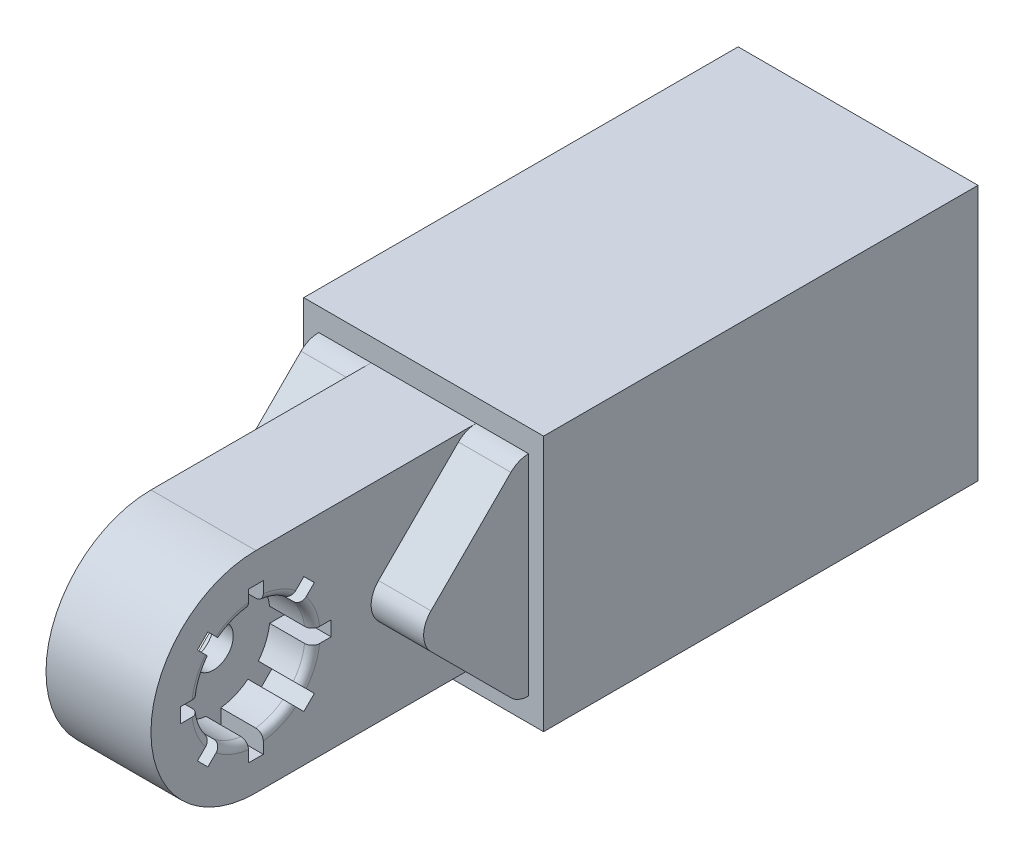
from build123d import *

# Parameters (mm, degrees)
SKETCH2_W                = 42
SKETCH2_H                = 42
BOSS_EXTRUDE1_DEPTH      = 89
SKETCH3_W                = 21
SKETCH3_H                = 42
BOSS_EXTRUDE2_DEPTH      = 42
BOSS_EXTRUDE3_DEPTH      = 21
SKETCH9_R                = 11.35
CUT_EXTRUDE2_DEPTH       = 8.5
CUT_EXTRUDE3_START       = -8.5
SKETCH11_R               = 11.35
CUT_EXTRUDE3_DEPTH       = 8.5
SKETCH12_R               = 3.975
CUT_EXTRUDE4_DEPTH       = 156.157984003
BOSS_EXTRUDE4_DEPTH      = 10.5
BOSS_EXTRUDE4_DEPTH_BACK = 31.5
FILLET1_R                = 5
FILLET2_R                = 5
FILLET3_R                = 5
FILLET4_R                = 5
FILLET5_R                = 5
FILLET6_R                = 5
FILLET7_R                = 1.5
FILLET8_R                = 1.5
SKETCH21_W               = 2.95860585
SKETCH21_H               = 4.417
CUT_EXTRUDE5_DEPTH       = 8.5
CIRPATTERN2_COUNT        = 8
MIRROR1_COPY_1_SKETCH_W  = 2.95860585
MIRROR1_COPY_1_SKETCH_H  = 4.417
MIRROR1_COPY_1_DEPTH     = 8.5
MIRROR1_COPY_2_SKETCH_W  = 2.95860585
MIRROR1_COPY_2_SKETCH_H  = 4.417
MIRROR1_COPY_2_DEPTH     = 8.5
MIRROR1_COPY_3_SKETCH_W  = 2.95860585
MIRROR1_COPY_3_SKETCH_H  = 4.417
MIRROR1_COPY_3_DEPTH     = 8.5
MIRROR1_COPY_4_SKETCH_W  = 2.95860585
MIRROR1_COPY_4_SKETCH_H  = 4.417
MIRROR1_COPY_4_DEPTH     = 8.5
MIRROR1_COPY_5_SKETCH_W  = 2.95860585
MIRROR1_COPY_5_SKETCH_H  = 4.417
MIRROR1_COPY_5_DEPTH     = 8.5
MIRROR1_COPY_6_SKETCH_W  = 2.95860585
MIRROR1_COPY_6_SKETCH_H  = 4.417
MIRROR1_COPY_6_DEPTH     = 8.5
MIRROR1_COPY_7_SKETCH_W  = 2.95860585
MIRROR1_COPY_7_SKETCH_H  = 4.417
MIRROR1_COPY_7_DEPTH     = 8.5
MIRROR1_COPY_8_SKETCH_W  = 2.95860585
MIRROR1_COPY_8_SKETCH_H  = 4.417
MIRROR1_COPY_8_DEPTH     = 8.5
SKETCH24_W               = 86.928932188
SKETCH24_H               = 4.545220174
SKETCH24_H_2             = 4.689106432
BOSS_EXTRUDE6_DEPTH      = 42
SKETCH25_W               = 86.928932188
SKETCH25_H               = 51.234326606
BOSS_EXTRUDE7_DEPTH      = 3
SKETCH28_W               = 86.928932188
SKETCH28_H               = 51.234326606
BOSS_EXTRUDE8_DEPTH      = 3
SKETCH30_W               = 62
SKETCH30_H               = 41.004326606
CUT_EXTRUDE6_DEPTH       = 45


with BuildPart() as part:
    # Sketch2 → Boss-Extrude1 (new body)
    with BuildSketch(Plane.XY):
        Rectangle(SKETCH2_W, SKETCH2_H)
    extrude(amount=BOSS_EXTRUDE1_DEPTH)

    # Sketch3 → Boss-Extrude2 (add)
    with BuildSketch(Plane.XY.offset(89)):
        Rectangle(SKETCH3_W, SKETCH3_H)
    extrude(amount=BOSS_EXTRUDE2_DEPTH)

    # Sketch8 → Boss-Extrude3 (add)
    with BuildSketch(Plane.ZY.offset(10.5)):
        with BuildLine():
            Line((131, 21), (131, -21))
            ThreePointArc((131, -21), (152, 0), (131, 21))
        make_face()
    extrude(amount=-BOSS_EXTRUDE3_DEPTH)

    # Sketch9 → Cut-Extrude2 (cut)
    with BuildSketch(Plane.ZY.offset(10.5)):
        with Locations((131, 0)):
            Circle(SKETCH9_R)
    extrude(amount=-CUT_EXTRUDE2_DEPTH, mode=Mode.SUBTRACT)

    # Sketch11 → Cut-Extrude3 (cut)
    with BuildSketch(Plane(origin=(10.5, 0, 0), x_dir=(0, 0, -1), z_dir=(1, 0, 0)).offset(CUT_EXTRUDE3_START)):
        with Locations((-131, 0)):
            Circle(SKETCH11_R)
    extrude(amount=CUT_EXTRUDE3_DEPTH, mode=Mode.SUBTRACT)

    # Sketch12 → Cut-Extrude4 (cut, through all)
    with BuildSketch(Plane.ZY.offset(2)):
        with Locations((131, 0)):
            Circle(SKETCH12_R)
    extrude(amount=-CUT_EXTRUDE4_DEPTH, mode=Mode.SUBTRACT)

    # Sketch20 → Boss-Extrude4 (add, two sides: drawn at the far end of the back side and taken through both)
    with BuildSketch(Plane.ZY.offset(10.5).offset(-BOSS_EXTRUDE4_DEPTH_BACK)):
        Polygon((89, -21), (110, 0), (89, 21), align=None)
    extrude(amount=BOSS_EXTRUDE4_DEPTH + BOSS_EXTRUDE4_DEPTH_BACK)

    # Fillet1
    fillet1_edges = [part.edges().sort_by_distance(p)[0] for p in [
        (15.75, 0, 110),
    ]]
    fillet(fillet1_edges, radius=FILLET1_R)

    # Fillet2
    fillet2_edges = [part.edges().sort_by_distance(p)[0] for p in [
        (-15.75, 0, 110),
    ]]
    fillet(fillet2_edges, radius=FILLET2_R)

    # Fillet3
    fillet3_edges = [part.edges().sort_by_distance(p)[0] for p in [
        (-15.75, -21, 89),
    ]]
    fillet(fillet3_edges, radius=FILLET3_R)

    # Fillet4
    fillet4_edges = [part.edges().sort_by_distance(p)[0] for p in [
        (-15.75, 21, 89),
    ]]
    fillet(fillet4_edges, radius=FILLET4_R)

    # Fillet5
    fillet5_edges = [part.edges().sort_by_distance(p)[0] for p in [
        (15.75, -21, 89),
    ]]
    fillet(fillet5_edges, radius=FILLET5_R)

    # Fillet6
    fillet6_edges = [part.edges().sort_by_distance(p)[0] for p in [
        (15.75, 21, 89),
    ]]
    fillet(fillet6_edges, radius=FILLET6_R)

    # Fillet7
    fillet7_edges = [part.edges().sort_by_distance(p)[0] for p in [
        (-10.5, 0, 119.65),
    ]]
    fillet(fillet7_edges, radius=FILLET7_R)

    # Fillet8
    fillet8_edges = [part.edges().sort_by_distance(p)[0] for p in [
        (10.5, 0, 142.35),
    ]]
    fillet(fillet8_edges, radius=FILLET8_R)

    # Sketch21 → Cut-Extrude5 (cut)
    with BuildSketch(Plane.ZY.offset(10.5)):
        with Locations((131, 12.85)):
            Rectangle(SKETCH21_W, SKETCH21_H)
    cut_extrude5 = extrude(amount=-CUT_EXTRUDE5_DEPTH, mode=Mode.SUBTRACT)

    # CirPattern2: Cut-Extrude5 ×8 about axis
    cirpattern2_axis = Axis((-9, 0, 131), (-1, 0, 0))
    for i in range(1, CIRPATTERN2_COUNT):
        add(cut_extrude5.rotate(cirpattern2_axis, i * 360 / CIRPATTERN2_COUNT), mode=Mode.SUBTRACT)

    # Mirror1 copy 1 sketch → Mirror1 copy 1 (cut)
    with BuildSketch(Plane(origin=(10.5, -92.630988335, 38.369011665), x_dir=(0, 0.7071067811865475, 0.7071067811865476), z_dir=(1, 0, 0))):
        with Locations((131, -12.85)):
            Rectangle(MIRROR1_COPY_1_SKETCH_W, MIRROR1_COPY_1_SKETCH_H)
    extrude(amount=-MIRROR1_COPY_1_DEPTH, mode=Mode.SUBTRACT)

    # Mirror1 copy 2 sketch → Mirror1 copy 2 (cut)
    with BuildSketch(Plane(origin=(10.5, -131, 131), x_dir=(0, 1, 0), z_dir=(1, 0, 0))):
        with Locations((131, -12.85)):
            Rectangle(MIRROR1_COPY_2_SKETCH_W, MIRROR1_COPY_2_SKETCH_H)
    extrude(amount=-MIRROR1_COPY_2_DEPTH, mode=Mode.SUBTRACT)

    # Mirror1 copy 3 sketch → Mirror1 copy 3 (cut)
    with BuildSketch(Plane(origin=(10.5, -92.630988335, 223.630988335), x_dir=(0, 0.7071067811865476, -0.7071067811865475), z_dir=(1, 0, 0))):
        with Locations((131, -12.85)):
            Rectangle(MIRROR1_COPY_3_SKETCH_W, MIRROR1_COPY_3_SKETCH_H)
    extrude(amount=-MIRROR1_COPY_3_DEPTH, mode=Mode.SUBTRACT)

    # Mirror1 copy 4 sketch → Mirror1 copy 4 (cut)
    with BuildSketch(Plane(origin=(10.5, 0, 262), x_dir=(0, 0, -1), z_dir=(1, 0, 0))):
        with Locations((131, -12.85)):
            Rectangle(MIRROR1_COPY_4_SKETCH_W, MIRROR1_COPY_4_SKETCH_H)
    extrude(amount=-MIRROR1_COPY_4_DEPTH, mode=Mode.SUBTRACT)

    # Mirror1 copy 5 sketch → Mirror1 copy 5 (cut)
    with BuildSketch(Plane(origin=(10.5, 92.630988335, 223.630988335), x_dir=(0, -0.7071067811865475, -0.7071067811865477), z_dir=(1, 0, 0))):
        with Locations((131, -12.85)):
            Rectangle(MIRROR1_COPY_5_SKETCH_W, MIRROR1_COPY_5_SKETCH_H)
    extrude(amount=-MIRROR1_COPY_5_DEPTH, mode=Mode.SUBTRACT)

    # Mirror1 copy 6 sketch → Mirror1 copy 6 (cut)
    with BuildSketch(Plane(origin=(10.5, 131, 131), x_dir=(0, -1, 0), z_dir=(1, 0, 0))):
        with Locations((131, -12.85)):
            Rectangle(MIRROR1_COPY_6_SKETCH_W, MIRROR1_COPY_6_SKETCH_H)
    extrude(amount=-MIRROR1_COPY_6_DEPTH, mode=Mode.SUBTRACT)

    # Mirror1 copy 7 sketch → Mirror1 copy 7 (cut)
    with BuildSketch(Plane(origin=(10.5, 92.630988335, 38.369011665), x_dir=(0, -0.7071067811865477, 0.7071067811865474), z_dir=(1, 0, 0))):
        with Locations((131, -12.85)):
            Rectangle(MIRROR1_COPY_7_SKETCH_W, MIRROR1_COPY_7_SKETCH_H)
    extrude(amount=-MIRROR1_COPY_7_DEPTH, mode=Mode.SUBTRACT)

    # Mirror1 copy 8 sketch → Mirror1 copy 8 (cut)
    with BuildSketch(Plane(origin=(10.5, 0, 0), x_dir=(0, 0, 1), z_dir=(1, 0, 0))):
        with Locations((131, -12.85)):
            Rectangle(MIRROR1_COPY_8_SKETCH_W, MIRROR1_COPY_8_SKETCH_H)
    extrude(amount=-MIRROR1_COPY_8_DEPTH, mode=Mode.SUBTRACT)

    # Sketch24 → Boss-Extrude6 (add)
    with BuildSketch(Plane(origin=(21, 0, 0), x_dir=(0, 0, -1), z_dir=(1, 0, 0))):
        with Locations((-43.464466094, 23.272610087)):
            Rectangle(SKETCH24_W, SKETCH24_H)
        with Locations((-43.464466094, -23.344553216)):
            Rectangle(SKETCH24_W, SKETCH24_H_2)
    extrude(amount=-BOSS_EXTRUDE6_DEPTH)

    # Sketch25 → Boss-Extrude7 (add)
    with BuildSketch(Plane(origin=(21, 0, 0), x_dir=(0, 0, -1), z_dir=(1, 0, 0))):
        with Locations((-43.464466094, -0.071943129)):
            Rectangle(SKETCH25_W, SKETCH25_H)
    extrude(amount=BOSS_EXTRUDE7_DEPTH)

    # Sketch28 → Boss-Extrude8 (add)
    with BuildSketch(Plane.ZY.offset(21)):
        with Locations((43.464466094, -0.071943129)):
            Rectangle(SKETCH28_W, SKETCH28_H)
    extrude(amount=BOSS_EXTRUDE8_DEPTH)

    # Sketch30 → Cut-Extrude6 (cut)
    with BuildSketch(Plane.ZY.offset(24)):
        with Locations((50.928932188, -0.071943129)):
            Rectangle(SKETCH30_W, SKETCH30_H)
    extrude(amount=-CUT_EXTRUDE6_DEPTH, mode=Mode.SUBTRACT)


solid = part.part
